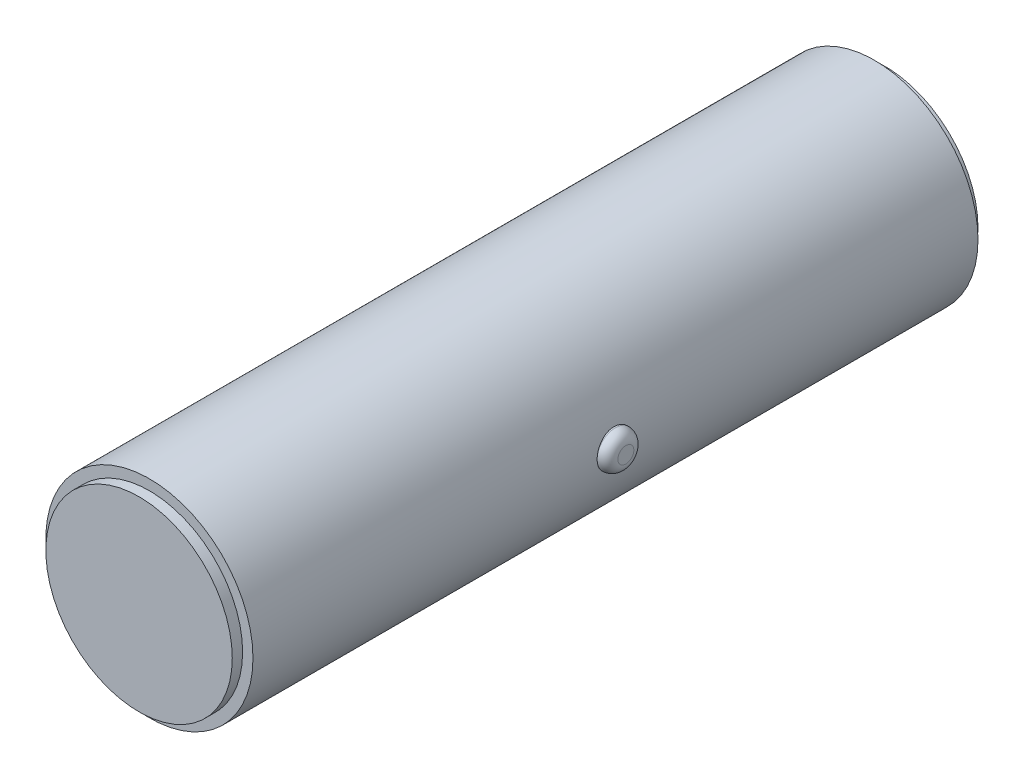
from build123d import *

# Parameters (mm, degrees)
SKETCH1_R                = 2.5
BOSS_EXTRUDE1_DEPTH      = 17.5
SKETCH2_R                = 2.25
BOSS_EXTRUDE2_DEPTH      = 0.25
BOSS_EXTRUDE3_START      = 0.25
SKETCH3_R                = 2.25
BOSS_EXTRUDE3_DEPTH      = 0.25
SKETCH4_R                = 0.25
BOSS_EXTRUDE4_DEPTH      = 1
BOSS_EXTRUDE5_DEPTH      = 2.75
BOSS_EXTRUDE5_DEPTH_BACK = 2.75
SKETCH5_R                = 0.442588638
FILLET1_R                = 0.25


with BuildPart() as part:
    # Sketch1 → Boss-Extrude1 (new body)
    with BuildSketch(Plane.XY):
        Circle(SKETCH1_R)
    extrude(amount=BOSS_EXTRUDE1_DEPTH)

    # Sketch2 → Boss-Extrude2 (add)
    with BuildSketch(Plane.XY.offset(17.5)):
        Circle(SKETCH2_R)
    extrude(amount=BOSS_EXTRUDE2_DEPTH)

    # Sketch3 → Boss-Extrude3 (add)
    with BuildSketch(Plane(origin=(0, 0, 0), x_dir=(-1, 0, 0), z_dir=(0, 0, -1)).offset(BOSS_EXTRUDE3_START)):
        with Locations(Location((0, 0, 0), (0, 0, 180))):
            Circle(SKETCH3_R)
    extrude(amount=-BOSS_EXTRUDE3_DEPTH)

    # Sketch4 → Boss-Extrude4 (add)
    with BuildSketch(Plane(origin=(0, 0, -0.25), x_dir=(-1, 0, 0), z_dir=(0, 0, -1))):
        Circle(SKETCH4_R)
    extrude(amount=BOSS_EXTRUDE4_DEPTH)

    # Sketch5 → Boss-Extrude5 (add, two sides: drawn at the far end of the back side and taken through both)
    with BuildSketch(Plane(origin=(0, 0, 0), x_dir=(0, 0, -1), z_dir=(1, 0, 0)).offset(-BOSS_EXTRUDE5_DEPTH_BACK)):
        with Locations((-8.75, 0)):
            Circle(SKETCH5_R)
    extrude(amount=BOSS_EXTRUDE5_DEPTH + BOSS_EXTRUDE5_DEPTH_BACK)

    # Fillet1
    fillet1_edges = [part.edges().sort_by_distance(p)[0] for p in [
        (-2.75, 0, 9.192588638),
        (2.75, 0, 9.192588638),
    ]]
    fillet(fillet1_edges, radius=FILLET1_R - 0.0001)  # a hair under: the kernel refuses the full size


solid = part.part
